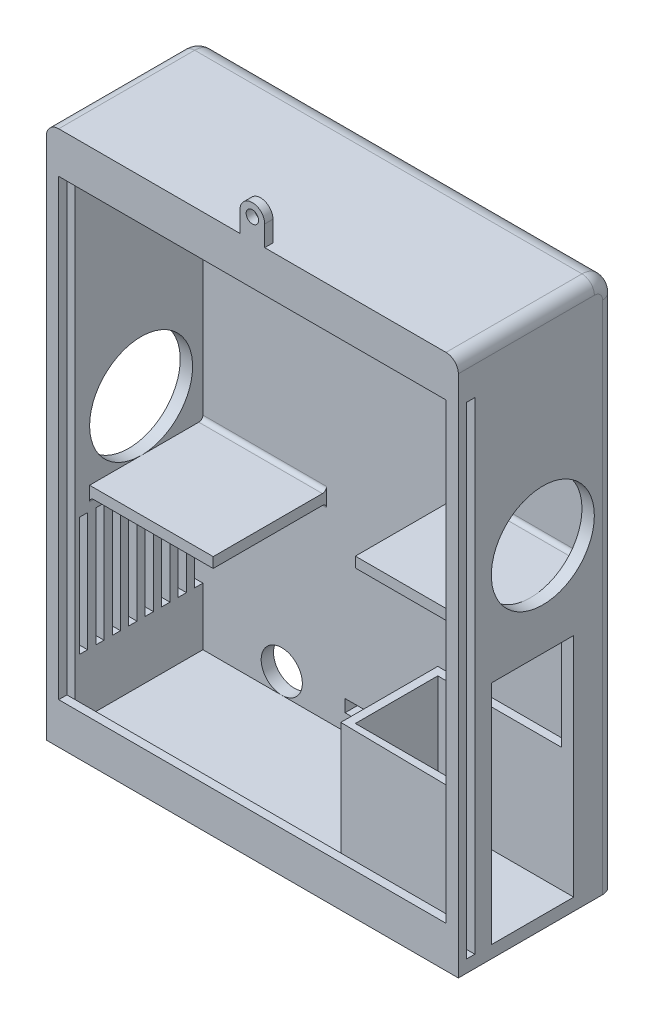
from build123d import *

# Parameters (mm, degrees)
IZIM1_W                      = 100
IZIM1_H                      = 130
Y_KSEKLIK_EKSTR_ZYON1_DEPTH  = 35
IZIM2_W                      = 94
IZIM2_H                      = 124
KES_EKSTR_ZYON1_DEPTH        = 27
IZIM3_W                      = 72
IZIM3_H                      = 25
KES_EKSTR_ZYON2_DEPTH        = 27
IZIM4_W                      = 25
IZIM4_H                      = 3
KES_EKSTR_ZYON3_DEPTH        = 27
IZIM7_W                      = 20
IZIM7_H                      = 55
KES_EKSTR_ZYON5_DEPTH        = 27
IZIM8_R                      = 12.5
KES_EKSTR_ZYON7_DEPTH        = 27
IZIM9_R                      = 12.5
KES_EKSTR_ZYON8_DEPTH        = 27
IZIM12_W                     = 94
IZIM12_H                     = 124
KES_EKSTR_ZYON9_DEPTH        = 5
IZIM13_W                     = 28.453191741
IZIM13_H                     = 38.236186197
Y_KSEKLIK_EKSTR_ZYON2_DEPTH  = 3
IZIM14_R                     = 12.5
KES_EKSTR_ZYON10_DEPTH       = 12
IZIM15_R                     = 5
KES_EKSTR_ZYON12_DEPTH       = 12
IZIM16_W                     = 29
IZIM16_H                     = 28.82133995
KES_EKSTR_ZYON13_DEPTH       = 12
IZIM17_W                     = 2
IZIM17_H                     = 28.82133995
Y_KSEKLIK_EKSTR_ZYON3_DEPTH  = 3
IZIM18_W                     = 3
IZIM18_H                     = 28.82133995
KES_EKSTR_ZYON14_DEPTH       = 1
IZIM20_W                     = 3
IZIM20_H                     = 130
Y_KSEKLIK_EKSTR_ZYON4_DEPTH  = 3
IZIM21_W                     = 3
IZIM21_H                     = 130
Y_KSEKLIK_EKSTR_ZYON5_DEPTH  = 3
IZIM22_W                     = 94
IZIM22_H                     = 3
Y_KSEKLIK_EKSTR_ZYON6_DEPTH  = 3
IZIM23_W                     = 94
IZIM23_H                     = 3
Y_KSEKLIK_EKSTR_ZYON8_DEPTH  = 3
IZIM24_W                     = 94
IZIM24_H                     = 2
Y_KSEKLIK_EKSTR_ZYON9_DEPTH  = 7
IZIM25_W                     = 94
IZIM25_H                     = 2
Y_KSEKLIK_EKSTR_ZYON10_DEPTH = 7
IZIM28_W                     = 2
IZIM28_H                     = 117
KES_EKSTR_ZYON16_DEPTH       = 119
Y_KSEKLIK_EKSTR_ZYON13_DEPTH = 2
Y_KSEKLIK_EKSTR_ZYON14_DEPTH = 30
Y_KSEKLIK_EKSTR_ZYON16_DEPTH = 30
IZIM33_W                     = 27.5
IZIM33_H                     = 2.5
Y_KSEKLIK_EKSTR_ZYON17_DEPTH = 30
RADYUS2_R                    = 1
RADYUS3_R                    = 1
RADYUS4_R                    = 5
RADYUS5_R                    = 3
RADYUS6_R                    = 3
RADYUS7_R                    = 1
RADYUS8_R                    = 1
RADYUS9_R                    = 1
RADYUS12_R                   = 1


# Some blends are built 0.0001 mm under size
with BuildPart() as part:
    # Çizim1 → Yükseklik-Ekstrüzyon1 (new body)
    with BuildSketch(Plane.XY):
        with Locations((-49.907227327, 1.17866005)):
            Rectangle(IZIM1_W, IZIM1_H)
    extrude(amount=Y_KSEKLIK_EKSTR_ZYON1_DEPTH)

    # Çizim2 → Kes-Ekstrüzyon1 (cut)
    with BuildSketch(Plane.XY.offset(35)):
        with Locations((-49.907227327, 1.17866005)):
            Rectangle(IZIM2_W, IZIM2_H)
    extrude(amount=-KES_EKSTR_ZYON1_DEPTH, mode=Mode.SUBTRACT)

    # Çizim3 → Kes-Ekstrüzyon2 (cut)
    with BuildSketch(Plane(origin=(0, 0, 0), x_dir=(-1, 0, 0), z_dir=(0, 0, -1))):
        with Locations((49.907227327, 43.67866005)):
            Rectangle(IZIM3_W, IZIM3_H)
    extrude(amount=-KES_EKSTR_ZYON2_DEPTH, mode=Mode.SUBTRACT)

    # Çizim4 → Kes-Ekstrüzyon3 (cut)
    with BuildSketch(Plane(origin=(0, 0, 0), x_dir=(-1, 0, 0), z_dir=(0, 0, -1))):
        with Locations((49.907227327, -55.32133995)):
            Rectangle(IZIM4_W, IZIM4_H)
    extrude(amount=-KES_EKSTR_ZYON3_DEPTH, mode=Mode.SUBTRACT)

    # Çizim7 → Kes-Ekstrüzyon5 (cut)
    with BuildSketch(Plane(origin=(0.092772673, 0, 0), x_dir=(0, 0, -1), z_dir=(1, 0, 0))):
        with Locations((-20, -33.32133995)):
            Rectangle(IZIM7_W, IZIM7_H)
    extrude(amount=-KES_EKSTR_ZYON5_DEPTH, mode=Mode.SUBTRACT)

    # Çizim8 → Kes-Ekstrüzyon7 (cut)
    with BuildSketch(Plane.ZY.offset(99.907227327)):
        with Locations((18, 0)):
            Circle(IZIM8_R)
    extrude(amount=-KES_EKSTR_ZYON7_DEPTH, mode=Mode.SUBTRACT)

    # Çizim9 → Kes-Ekstrüzyon8 (cut)
    with BuildSketch(Plane(origin=(0.092772673, 0, 0), x_dir=(0, 0, -1), z_dir=(1, 0, 0))):
        with Locations((-21.5, 19.418739017)):
            Circle(IZIM9_R)
    extrude(amount=-KES_EKSTR_ZYON8_DEPTH, mode=Mode.SUBTRACT)

    # Çizim12 → Kes-Ekstrüzyon9 (cut)
    with BuildSketch(Plane.XY.offset(8)):
        with Locations((-49.907227327, 1.17866005)):
            Rectangle(IZIM12_W, IZIM12_H)
    extrude(amount=-KES_EKSTR_ZYON9_DEPTH, mode=Mode.SUBTRACT)

    # Çizim13 → Yükseklik-Ekstrüzyon2 (add)
    with BuildSketch(Plane(origin=(0.092772673, 0, 0), x_dir=(0, 0, -1), z_dir=(1, 0, 0))):
        with Locations((-20.77340413, 20.296753148)):
            Rectangle(IZIM13_W, IZIM13_H)
    extrude(amount=-Y_KSEKLIK_EKSTR_ZYON2_DEPTH)

    # Çizim14 → Kes-Ekstrüzyon10 (cut)
    with BuildSketch(Plane(origin=(0.092772673, 0, 0), x_dir=(0, 0, -1), z_dir=(1, 0, 0))):
        with Locations((-17.5, 16.852295745)):
            Circle(IZIM14_R)
    extrude(amount=-KES_EKSTR_ZYON10_DEPTH, mode=Mode.SUBTRACT)

    # Çizim15 → Kes-Ekstrüzyon12 (cut)
    with BuildSketch(Plane(origin=(0, 0, 0), x_dir=(-1, 0, 0), z_dir=(0, 0, -1))):
        with Locations((77.770167632, -55.82133995)):
            Circle(IZIM15_R)
    extrude(amount=-KES_EKSTR_ZYON12_DEPTH, mode=Mode.SUBTRACT)

    # Çizim16 → Kes-Ekstrüzyon13 (cut)
    with BuildSketch(Plane.ZY.offset(99.907227327)):
        with Locations((17.5, -32.410669975)):
            Rectangle(IZIM16_W, IZIM16_H)
    extrude(amount=-KES_EKSTR_ZYON13_DEPTH, mode=Mode.SUBTRACT)

    # Çizim17 → Yükseklik-Ekstrüzyon3 (add)
    with BuildSketch(Plane.ZY.offset(99.907227327)):
        with Locations((6, -32.410669975)):
            Rectangle(IZIM17_W, IZIM17_H)
        with Locations((10, -32.410669975)):
            Rectangle(IZIM17_W, IZIM17_H)
        with Locations((14, -32.410669975)):
            Rectangle(IZIM17_W, IZIM17_H)
        with Locations((18, -32.410669975)):
            Rectangle(IZIM17_W, IZIM17_H)
        with Locations((22, -32.410669975)):
            Rectangle(IZIM17_W, IZIM17_H)
        with Locations((26, -32.410669975)):
            Rectangle(IZIM17_W, IZIM17_H)
        with Locations((30, -32.410669975)):
            Rectangle(IZIM17_W, IZIM17_H)
    extrude(amount=-Y_KSEKLIK_EKSTR_ZYON3_DEPTH)

    # Çizim18 → Kes-Ekstrüzyon14 (cut)
    with BuildSketch(Plane(origin=(0, 0, 32), x_dir=(-1, 0, 0), z_dir=(0, 0, -1))):
        with Locations((98.407227327, -32.410669975)):
            Rectangle(IZIM18_W, IZIM18_H)
    extrude(amount=-KES_EKSTR_ZYON14_DEPTH, mode=Mode.SUBTRACT)

    # Çizim20 → Yükseklik-Ekstrüzyon4 (add)
    with BuildSketch(Plane.ZY.offset(99.907227327)):
        with Locations((36.5, 1.17866005)):
            Rectangle(IZIM20_W, IZIM20_H)
    extrude(amount=-Y_KSEKLIK_EKSTR_ZYON4_DEPTH)

    # Çizim21 → Yükseklik-Ekstrüzyon5 (add)
    with BuildSketch(Plane(origin=(0.092772673, 0, 0), x_dir=(0, 0, -1), z_dir=(1, 0, 0))):
        with Locations((-36.5, 1.17866005)):
            Rectangle(IZIM21_W, IZIM21_H)
    extrude(amount=-Y_KSEKLIK_EKSTR_ZYON5_DEPTH)

    # Çizim22 → Yükseklik-Ekstrüzyon6 (add)
    with BuildSketch(Plane(origin=(0, 66.17866005, 0), x_dir=(1, 0, 0), z_dir=(0, 1, 0))):
        with Locations((-49.907227327, -36.5)):
            Rectangle(IZIM22_W, IZIM22_H)
    extrude(amount=-Y_KSEKLIK_EKSTR_ZYON6_DEPTH)

    # Çizim23 → Yükseklik-Ekstrüzyon8 (add)
    with BuildSketch(Plane(origin=(0, -60.82133995, 0), x_dir=(1, 0, 0), z_dir=(0, 1, 0))):
        with Locations((-49.907227327, -36.5)):
            Rectangle(IZIM23_W, IZIM23_H)
    extrude(amount=-Y_KSEKLIK_EKSTR_ZYON8_DEPTH)

    # Çizim24 → Yükseklik-Ekstrüzyon9 (add)
    with BuildSketch(Plane.XZ.offset(-63.17866005)):
        with Locations((-49.907227327, 37)):
            Rectangle(IZIM24_W, IZIM24_H)
    extrude(amount=Y_KSEKLIK_EKSTR_ZYON9_DEPTH)

    # Çizim25 → Yükseklik-Ekstrüzyon10 (add)
    with BuildSketch(Plane(origin=(0, -60.82133995, 0), x_dir=(1, 0, 0), z_dir=(0, 1, 0))):
        with Locations((-49.907227327, -37)):
            Rectangle(IZIM25_W, IZIM25_H)
    extrude(amount=Y_KSEKLIK_EKSTR_ZYON10_DEPTH)

    # Çizim28 → Kes-Ekstrüzyon16 (cut)
    with BuildSketch(Plane(origin=(0.092772673, 0, 0), x_dir=(0, 0, -1), z_dir=(1, 0, 0))):
        with Locations((-35, -2.32133995)):
            Rectangle(IZIM28_W, IZIM28_H)
    extrude(amount=-KES_EKSTR_ZYON16_DEPTH, mode=Mode.SUBTRACT)

    # Çizim30 → Yükseklik-Ekstrüzyon13 (add)
    with BuildSketch(Plane.XY.offset(38)):
        with BuildLine():
            Line((-52.907227327, 66.17866005), (-49.907227327, 66.17866005))
            Line((-49.907227327, 66.17866005), (-49.907227327, 68.166838309))
            ThreePointArc((-49.907227327, 68.166838309), (-52.02854767, 69.045517966), (-52.907227327, 71.166838309))
            Line((-52.907227327, 71.166838309), (-52.907227327, 66.17866005))
        make_face()
        with BuildLine():
            Line((-49.907227327, 68.166838309), (-49.907227327, 66.17866005))
            Line((-49.907227327, 66.17866005), (-46.907227327, 66.17866005))
            Line((-46.907227327, 66.17866005), (-46.907227327, 71.166838309))
            ThreePointArc((-46.907227327, 71.166838309), (-47.785906983, 69.045517966), (-49.907227327, 68.166838309))
        make_face()
        with BuildLine():
            ThreePointArc((-52.907227327, 71.166838309), (-52.02854767, 69.045517966), (-49.907227327, 68.166838309))
            Line((-49.907227327, 68.166838309), (-49.907227327, 69.666838309))
            ThreePointArc((-49.907227327, 69.666838309), (-51.407227327, 71.166838309), (-49.907227327, 72.666838309))
            Line((-49.907227327, 72.666838309), (-49.907227327, 74.166838309))
            ThreePointArc((-49.907227327, 74.166838309), (-52.02854767, 73.288158653), (-52.907227327, 71.166838309))
        make_face()
        with BuildLine():
            Line((-49.907227327, 69.666838309), (-49.907227327, 68.166838309))
            ThreePointArc((-49.907227327, 68.166838309), (-47.785906983, 69.045517966), (-46.907227327, 71.166838309))
            ThreePointArc((-46.907227327, 71.166838309), (-47.785906983, 73.288158653), (-49.907227327, 74.166838309))
            Line((-49.907227327, 74.166838309), (-49.907227327, 72.666838309))
            ThreePointArc((-49.907227327, 72.666838309), (-48.846567155, 72.227498481), (-48.407227327, 71.166838309))
            ThreePointArc((-48.407227327, 71.166838309), (-48.846567155, 70.106178138), (-49.907227327, 69.666838309))
        make_face()
    extrude(amount=-Y_KSEKLIK_EKSTR_ZYON13_DEPTH)

    # Çizim31 → Yükseklik-Ekstrüzyon14 (add)
    with BuildSketch(Plane(origin=(0, -60.82133995, 0), x_dir=(1, 0, 0), z_dir=(0, 1, 0))):
        Polygon((-32.907227327, -10), (-32.907227327, -30), (-2.907227327, -30), (-2.907227327, -32), (-34.907227327, -31.543172405), (-34.907227327, -8), (-32.907227327, -8), (-2.907227327, -8), (-2.907227327, -10), align=None)
    extrude(amount=Y_KSEKLIK_EKSTR_ZYON14_DEPTH)

    # Çizim32 → Yükseklik-Ekstrüzyon16 (add)
    with BuildSketch(Plane.ZY.offset(2.907227327)):
        Polygon((30, 4.352295745), (5, 4.352295745), (3, 4.352295745), (3, 1.852295745), (5, 1.852295745), (30, 1.852295745), align=None)
    extrude(amount=Y_KSEKLIK_EKSTR_ZYON16_DEPTH)

    # Çizim33 → Yükseklik-Ekstrüzyon17 (add)
    with BuildSketch(Plane(origin=(-96.907227327, 0, 0), x_dir=(0, 0, -1), z_dir=(1, 0, 0))):
        with Locations((-16.75, -13.75)):
            Rectangle(IZIM33_W, IZIM33_H)
    extrude(amount=Y_KSEKLIK_EKSTR_ZYON17_DEPTH)

    # Radyus2
    radyus2_edges = [part.edges().sort_by_distance(p)[0] for p in [
        (-81.907227327, -12.5, 3),
    ]]
    fillet(radyus2_edges, radius=RADYUS2_R)

    # Radyus3
    radyus3_edges = [part.edges().sort_by_distance(p)[0] for p in [
        (-17.907227327, 4.352295745, 3),
    ]]
    fillet(radyus3_edges, radius=RADYUS3_R)

    # Radyus4
    radyus4_edges = [part.edges().sort_by_distance(p)[0] for p in [
        (-49.907227327, 66.17866005, 0),
    ]]
    fillet(radyus4_edges, radius=RADYUS4_R)

    # Radyus5
    radyus5_edges = [part.edges().sort_by_distance(p)[0] for p in [
        (0.092772673, -1.32133995, 0),
        (0.092772673, 64.714193956, 1.464466094),
        (0.092772673, 66.17866005, 21.5),
    ]]
    fillet(radyus5_edges, radius=RADYUS5_R)

    # Radyus6
    radyus6_edges = [part.edges().sort_by_distance(p)[0] for p in [
        (-99.907227327, -1.32133995, 0),
        (-99.907227327, 64.714193956, 1.464466094),
        (-99.907227327, 66.17866005, 21.5),
    ]]
    fillet(radyus6_edges, radius=RADYUS6_R - 0.0001)  # a hair under: the kernel refuses the full size

    # Radyus7
    radyus7_edges = [part.edges().sort_by_distance(p)[0] for p in [
        (-17.907227327, 1.852295745, 3),
    ]]
    fillet(radyus7_edges, radius=RADYUS7_R)

    # Radyus8
    radyus8_edges = [part.edges().sort_by_distance(p)[0] for p in [
        (-81.907227327, -15, 3),
    ]]
    fillet(radyus8_edges, radius=RADYUS8_R)

    # Radyus9
    radyus9_edges = [part.edges().sort_by_distance(p)[0] for p in [
        (-96.907227327, -15, 17.25),
        (-96.907227327, -17, 3),
        (-96.907227327, -15.292893219, 3.292893219),
    ]]
    fillet(radyus9_edges, radius=RADYUS9_R)

    # Radyus12
    # the kernel refuses this fillet: 1 mm, written as the material it adds along each edge
    with BuildSketch(Plane(origin=(-2.907227327, 1.852295745, 1.5), x_dir=(-1, 0, 0), z_dir=(0, 0, 1))) as radyus12_piece_1:
        with BuildLine():
            CenterArc((RADYUS12_R, RADYUS12_R), RADYUS12_R, 180, 90)
            Line((0, RADYUS12_R), (0, 0))
            Line((0, 0), (RADYUS12_R, 0))
        make_face()
    extrude(amount=28.5)


solid = part.part
